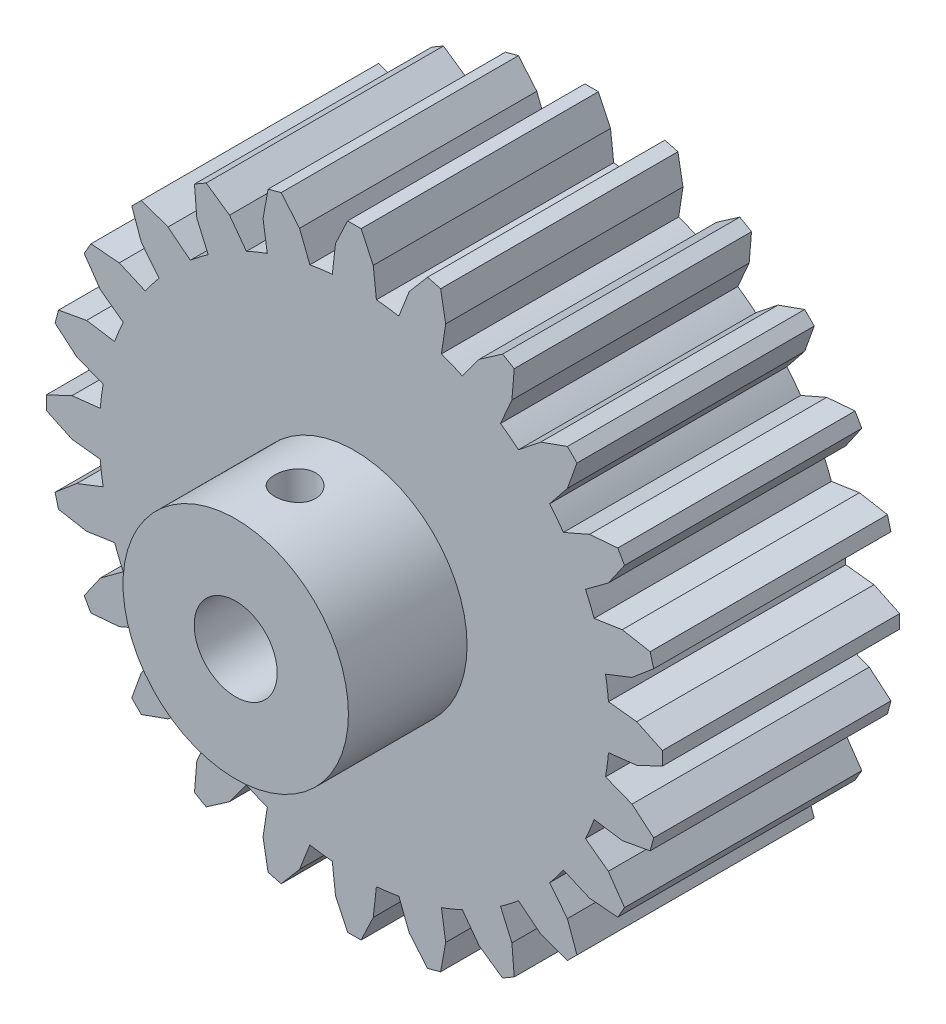
from build123d import *

# Parameters (mm, degrees)
ESQUISSE1_R             = 3.5
BOSS_EXTRU_1_DEPTH      = 20
ESQUISSE2_R             = 9.5
ESQUISSE2_R_2           = 3.5
BOSS_EXTRU_2_DEPTH      = 10
ESQUISSE3_R             = 1.725
ENL_V_MAT_EXTRU_1_DEPTH = 10


with BuildPart() as part:
    # Esquisse1 → Boss.-Extru.1 (new body)
    with BuildSketch(Plane.XY):
        with BuildLine():
            Line((-1.8585, 21.419523285), (-1.591531907, 23.799597451))
            Line((-1.591531907, 23.799597451), (-0.5695, 25.965578933))
            Line((-0.5695, 25.965578933), (0.5695, 25.965578933))
            Line((0.5695, 25.965578933), (1.591531907, 23.799597451))
            Line((1.591531907, 23.799597451), (1.8585, 21.419523285))
            ThreePointArc((1.8585, 21.419523285), (2.806313133, 21.31606452), (3.748607415, 21.170685923))
            Line((3.748607415, 21.170685923), (4.622487313, 23.400564602))
            Line((4.622487313, 23.400564602), (6.170291587, 25.228220732))
            Line((6.170291587, 25.228220732), (7.270481103, 24.93342584))
            Line((7.270481103, 24.93342584), (7.697090859, 22.576727065))
            Line((7.697090859, 22.576727065), (7.338953711, 20.208655532))
            ThreePointArc((7.338953711, 20.208655532), (8.227693796, 19.863409949), (9.100253429, 19.479101302))
            Line((9.100253429, 19.479101302), (10.521491663, 21.406821946))
            Line((10.521491663, 21.406821946), (12.489587999, 22.77160098))
            Line((12.489587999, 22.77160098), (13.475990934, 22.20210098))
            Line((13.475990934, 22.20210098), (13.278105788, 19.815290039))
            Line((13.278105788, 19.815290039), (12.319269855, 17.620601302))
            ThreePointArc((12.319269855, 17.620601302), (13.088370724, 17.057096816), (13.831732212, 16.460048117))
            Line((13.831732212, 16.460048117), (15.703473743, 17.954239751))
            Line((15.703473743, 17.954239751), (17.957739629, 18.763134253))
            Line((17.957739629, 18.763134253), (18.763134253, 17.957739629))
            Line((18.763134253, 17.957739629), (17.954239751, 15.703473743))
            Line((17.954239751, 15.703473743), (16.460048117, 13.831732212))
            ThreePointArc((16.460048117, 13.831732212), (17.057096816, 13.088370724), (17.620601302, 12.319269855))
            Line((17.620601302, 12.319269855), (19.815290039, 13.278105788))
            Line((19.815290039, 13.278105788), (22.20210098, 13.475990934))
            Line((22.20210098, 13.475990934), (22.77160098, 12.489587999))
            Line((22.77160098, 12.489587999), (21.406821946, 10.521491663))
            Line((21.406821946, 10.521491663), (19.479101302, 9.100253429))
            ThreePointArc((19.479101302, 9.100253429), (19.863409949, 8.227693796), (20.208655532, 7.338953711))
            Line((20.208655532, 7.338953711), (22.576727065, 7.697090859))
            Line((22.576727065, 7.697090859), (24.93342584, 7.270481103))
            Line((24.93342584, 7.270481103), (25.228220732, 6.170291587))
            Line((25.228220732, 6.170291587), (23.400564602, 4.622487313))
            Line((23.400564602, 4.622487313), (21.170685923, 3.748607415))
            ThreePointArc((21.170685923, 3.748607415), (21.31606452, 2.806313133), (21.419523285, 1.8585))
            Line((21.419523285, 1.8585), (23.799597451, 1.591531907))
            Line((23.799597451, 1.591531907), (25.965578933, 0.5695))
            Line((25.965578933, 0.5695), (25.965578933, -0.5695))
            Line((25.965578933, -0.5695), (23.799597451, -1.591531907))
            Line((23.799597451, -1.591531907), (21.419523285, -1.8585))
            ThreePointArc((21.419523285, -1.8585), (21.31606452, -2.806313133), (21.170685923, -3.748607415))
            Line((21.170685923, -3.748607415), (23.400564602, -4.622487313))
            Line((23.400564602, -4.622487313), (25.228220732, -6.170291587))
            Line((25.228220732, -6.170291587), (24.93342584, -7.270481103))
            Line((24.93342584, -7.270481103), (22.576727065, -7.697090859))
            Line((22.576727065, -7.697090859), (20.208655532, -7.338953711))
            ThreePointArc((20.208655532, -7.338953711), (19.863409949, -8.227693796), (19.479101302, -9.100253429))
            Line((19.479101302, -9.100253429), (21.406821946, -10.521491663))
            Line((21.406821946, -10.521491663), (22.77160098, -12.489587999))
            Line((22.77160098, -12.489587999), (22.20210098, -13.475990934))
            Line((22.20210098, -13.475990934), (19.815290039, -13.278105788))
            Line((19.815290039, -13.278105788), (17.620601302, -12.319269855))
            ThreePointArc((17.620601302, -12.319269855), (17.057096816, -13.088370724), (16.460048117, -13.831732212))
            Line((16.460048117, -13.831732212), (17.954239751, -15.703473743))
            Line((17.954239751, -15.703473743), (18.763134253, -17.957739629))
            Line((18.763134253, -17.957739629), (17.957739629, -18.763134253))
            Line((17.957739629, -18.763134253), (15.703473743, -17.954239751))
            Line((15.703473743, -17.954239751), (13.831732212, -16.460048117))
            ThreePointArc((13.831732212, -16.460048117), (13.088370724, -17.057096816), (12.319269855, -17.620601302))
            Line((12.319269855, -17.620601302), (13.278105788, -19.815290039))
            Line((13.278105788, -19.815290039), (13.475990934, -22.20210098))
            Line((13.475990934, -22.20210098), (12.489587999, -22.77160098))
            Line((12.489587999, -22.77160098), (10.521491663, -21.406821946))
            Line((10.521491663, -21.406821946), (9.100253429, -19.479101302))
            ThreePointArc((9.100253429, -19.479101302), (8.227693796, -19.863409949), (7.338953711, -20.208655532))
            Line((7.338953711, -20.208655532), (7.697090859, -22.576727065))
            Line((7.697090859, -22.576727065), (7.270481103, -24.93342584))
            Line((7.270481103, -24.93342584), (6.170291587, -25.228220732))
            Line((6.170291587, -25.228220732), (4.622487313, -23.400564602))
            Line((4.622487313, -23.400564602), (3.748607415, -21.170685923))
            ThreePointArc((3.748607415, -21.170685923), (2.806313133, -21.31606452), (1.8585, -21.419523285))
            Line((1.8585, -21.419523285), (1.591531907, -23.799597451))
            Line((1.591531907, -23.799597451), (0.5695, -25.965578933))
            Line((0.5695, -25.965578933), (-0.5695, -25.965578933))
            Line((-0.5695, -25.965578933), (-1.591531907, -23.799597451))
            Line((-1.591531907, -23.799597451), (-1.8585, -21.419523285))
            ThreePointArc((-1.8585, -21.419523285), (-2.806313133, -21.31606452), (-3.748607415, -21.170685923))
            Line((-3.748607415, -21.170685923), (-4.622487313, -23.400564602))
            Line((-4.622487313, -23.400564602), (-6.170291587, -25.228220732))
            Line((-6.170291587, -25.228220732), (-7.270481103, -24.93342584))
            Line((-7.270481103, -24.93342584), (-7.697090859, -22.576727065))
            Line((-7.697090859, -22.576727065), (-7.338953711, -20.208655532))
            ThreePointArc((-7.338953711, -20.208655532), (-8.227693796, -19.863409949), (-9.100253429, -19.479101302))
            Line((-9.100253429, -19.479101302), (-10.521491663, -21.406821946))
            Line((-10.521491663, -21.406821946), (-12.489587999, -22.77160098))
            Line((-12.489587999, -22.77160098), (-13.475990934, -22.20210098))
            Line((-13.475990934, -22.20210098), (-13.278105788, -19.815290039))
            Line((-13.278105788, -19.815290039), (-12.319269855, -17.620601302))
            ThreePointArc((-12.319269855, -17.620601302), (-13.088370724, -17.057096816), (-13.831732212, -16.460048117))
            Line((-13.831732212, -16.460048117), (-15.703473743, -17.954239751))
            Line((-15.703473743, -17.954239751), (-17.957739629, -18.763134253))
            Line((-17.957739629, -18.763134253), (-18.763134253, -17.957739629))
            Line((-18.763134253, -17.957739629), (-17.954239751, -15.703473743))
            Line((-17.954239751, -15.703473743), (-16.460048117, -13.831732212))
            ThreePointArc((-16.460048117, -13.831732212), (-17.057096816, -13.088370724), (-17.620601302, -12.319269855))
            Line((-17.620601302, -12.319269855), (-19.815290039, -13.278105788))
            Line((-19.815290039, -13.278105788), (-22.20210098, -13.475990934))
            Line((-22.20210098, -13.475990934), (-22.77160098, -12.489587999))
            Line((-22.77160098, -12.489587999), (-21.406821946, -10.521491663))
            Line((-21.406821946, -10.521491663), (-19.479101302, -9.100253429))
            ThreePointArc((-19.479101302, -9.100253429), (-19.863409949, -8.227693796), (-20.208655532, -7.338953711))
            Line((-20.208655532, -7.338953711), (-22.576727065, -7.697090859))
            Line((-22.576727065, -7.697090859), (-24.93342584, -7.270481103))
            Line((-24.93342584, -7.270481103), (-25.228220732, -6.170291587))
            Line((-25.228220732, -6.170291587), (-23.400564602, -4.622487313))
            Line((-23.400564602, -4.622487313), (-21.170685923, -3.748607415))
            ThreePointArc((-21.170685923, -3.748607415), (-21.31606452, -2.806313133), (-21.419523285, -1.8585))
            Line((-21.419523285, -1.8585), (-23.799597451, -1.591531907))
            Line((-23.799597451, -1.591531907), (-25.965578933, -0.5695))
            Line((-25.965578933, -0.5695), (-25.965578933, 0.5695))
            Line((-25.965578933, 0.5695), (-23.799597451, 1.591531907))
            Line((-23.799597451, 1.591531907), (-21.419523285, 1.8585))
            ThreePointArc((-21.419523285, 1.8585), (-21.31606452, 2.806313133), (-21.170685923, 3.748607415))
            Line((-21.170685923, 3.748607415), (-23.400564602, 4.622487313))
            Line((-23.400564602, 4.622487313), (-25.228220732, 6.170291587))
            Line((-25.228220732, 6.170291587), (-24.93342584, 7.270481103))
            Line((-24.93342584, 7.270481103), (-22.576727065, 7.697090859))
            Line((-22.576727065, 7.697090859), (-20.208655532, 7.338953711))
            ThreePointArc((-20.208655532, 7.338953711), (-19.863409949, 8.227693796), (-19.479101302, 9.100253429))
            Line((-19.479101302, 9.100253429), (-21.406821946, 10.521491663))
            Line((-21.406821946, 10.521491663), (-22.77160098, 12.489587999))
            Line((-22.77160098, 12.489587999), (-22.20210098, 13.475990934))
            Line((-22.20210098, 13.475990934), (-19.815290039, 13.278105788))
            Line((-19.815290039, 13.278105788), (-17.620601302, 12.319269855))
            ThreePointArc((-17.620601302, 12.319269855), (-17.057096816, 13.088370724), (-16.460048117, 13.831732212))
            Line((-16.460048117, 13.831732212), (-17.954239751, 15.703473743))
            Line((-17.954239751, 15.703473743), (-18.763134253, 17.957739629))
            Line((-18.763134253, 17.957739629), (-17.957739629, 18.763134253))
            Line((-17.957739629, 18.763134253), (-15.703473743, 17.954239751))
            Line((-15.703473743, 17.954239751), (-13.831732212, 16.460048117))
            ThreePointArc((-13.831732212, 16.460048117), (-13.088370724, 17.057096816), (-12.319269855, 17.620601302))
            Line((-12.319269855, 17.620601302), (-13.278105788, 19.815290039))
            Line((-13.278105788, 19.815290039), (-13.475990934, 22.20210098))
            Line((-13.475990934, 22.20210098), (-12.489587999, 22.77160098))
            Line((-12.489587999, 22.77160098), (-10.521491663, 21.406821946))
            Line((-10.521491663, 21.406821946), (-9.100253429, 19.479101302))
            ThreePointArc((-9.100253429, 19.479101302), (-8.227693796, 19.863409949), (-7.338953711, 20.208655532))
            Line((-7.338953711, 20.208655532), (-7.697090859, 22.576727065))
            Line((-7.697090859, 22.576727065), (-7.270481103, 24.93342584))
            Line((-7.270481103, 24.93342584), (-6.170291587, 25.228220732))
            Line((-6.170291587, 25.228220732), (-4.622487313, 23.400564602))
            Line((-4.622487313, 23.400564602), (-3.748607415, 21.170685923))
            ThreePointArc((-3.748607415, 21.170685923), (-2.806313133, 21.31606452), (-1.8585, 21.419523285))
        make_face()
        Circle(ESQUISSE1_R, mode=Mode.SUBTRACT)
    extrude(amount=BOSS_EXTRU_1_DEPTH)

    # Esquisse2 → Boss.-Extru.2 (add)
    with BuildSketch(Plane.XY.offset(20)):
        Circle(ESQUISSE2_R)
        Circle(ESQUISSE2_R_2, mode=Mode.SUBTRACT)
    extrude(amount=BOSS_EXTRU_2_DEPTH)

    # Esquisse3 → Enlèv. mat.-Extru.1 (cut)
    with BuildSketch(Plane(origin=(0, 0, 0), x_dir=(1, 0, 0), z_dir=(0, 1, 0))):
        with Locations((0, -25)):
            Circle(ESQUISSE3_R)
    extrude(amount=ENL_V_MAT_EXTRU_1_DEPTH, mode=Mode.SUBTRACT)


solid = part.part
